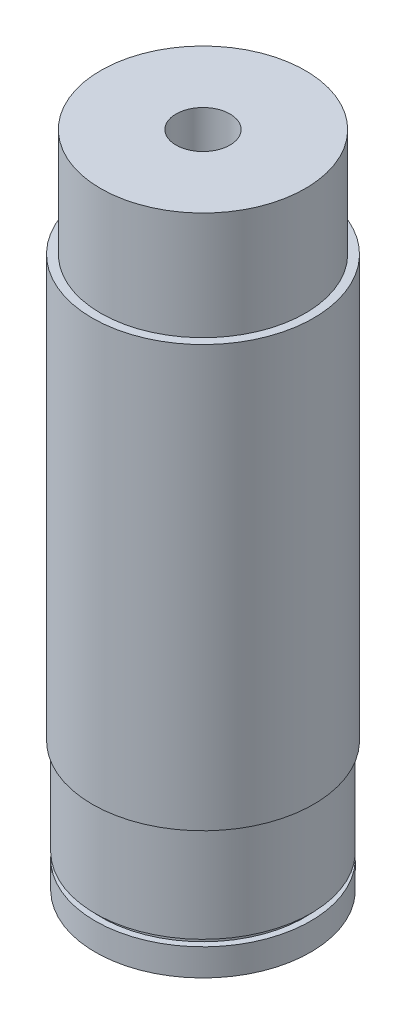
from build123d import *

# Parameters (mm, degrees)
ESQUISSE1_R             = 20.5
BOSS_EXTRU_1_DEPTH      = 122
ESQUISSE2_OUTSIDE_W     = 70.016
ESQUISSE2_OUTSIDE_H     = 70.016
ESQUISSE2_OUTSIDE_R     = 18.95
ENL_V_MAT_EXTRU_1_DEPTH = 20
ESQUISSE3_OUTSIDE_W     = 70.016
ESQUISSE3_OUTSIDE_H     = 70.016
ESQUISSE3_OUTSIDE_R     = 19.95
ENL_V_MAT_EXTRU_2_DEPTH = 24
ESQUISSE4_W             = 2.3
ESQUISSE4_H             = 1.2
ESQUISSE5_R             = 5
ENL_V_MAT_EXTRU_3_DEPTH = 126.397368393


with BuildPart() as part:
    # Esquisse1 → Boss.-Extru.1 (new body)
    with BuildSketch(Plane(origin=(0, 0, 0), x_dir=(1, 0, 0), z_dir=(0, 1, 0))):
        Circle(ESQUISSE1_R)
    extrude(amount=BOSS_EXTRU_1_DEPTH)

    # Esquisse2 outside → Enlèv. mat.-Extru.1 (cut)
    with BuildSketch(Plane(origin=(0, 122, 0), x_dir=(1, 0, 0), z_dir=(0, 1, 0))):
        Rectangle(ESQUISSE2_OUTSIDE_W, ESQUISSE2_OUTSIDE_H)
        Circle(ESQUISSE2_OUTSIDE_R, mode=Mode.SUBTRACT)
    extrude(amount=-ENL_V_MAT_EXTRU_1_DEPTH, mode=Mode.SUBTRACT)

    # Esquisse3 outside → Enlèv. mat.-Extru.2 (cut)
    with BuildSketch(Plane.XZ):
        Rectangle(ESQUISSE3_OUTSIDE_W, ESQUISSE3_OUTSIDE_H)
        Circle(ESQUISSE3_OUTSIDE_R, mode=Mode.SUBTRACT)
    extrude(amount=-ENL_V_MAT_EXTRU_2_DEPTH, mode=Mode.SUBTRACT)

    # Esquisse4 → Enlèvement de matière-Révolution1 (revolve, cut)
    with BuildSketch(Plane.XY):
        with Locations((-19.95, 5.6)):
            Rectangle(ESQUISSE4_W, ESQUISSE4_H)
    revolve(axis=Axis((0, 0, 0), (0, 1, 0)), mode=Mode.SUBTRACT)

    # Esquisse5 → Enlèv. mat.-Extru.3 (cut, through all)
    with BuildSketch(Plane(origin=(0, 122, 0), x_dir=(1, 0, 0), z_dir=(0, 1, 0))):
        Circle(ESQUISSE5_R)
    extrude(amount=-ENL_V_MAT_EXTRU_3_DEPTH, mode=Mode.SUBTRACT)


solid = part.part
